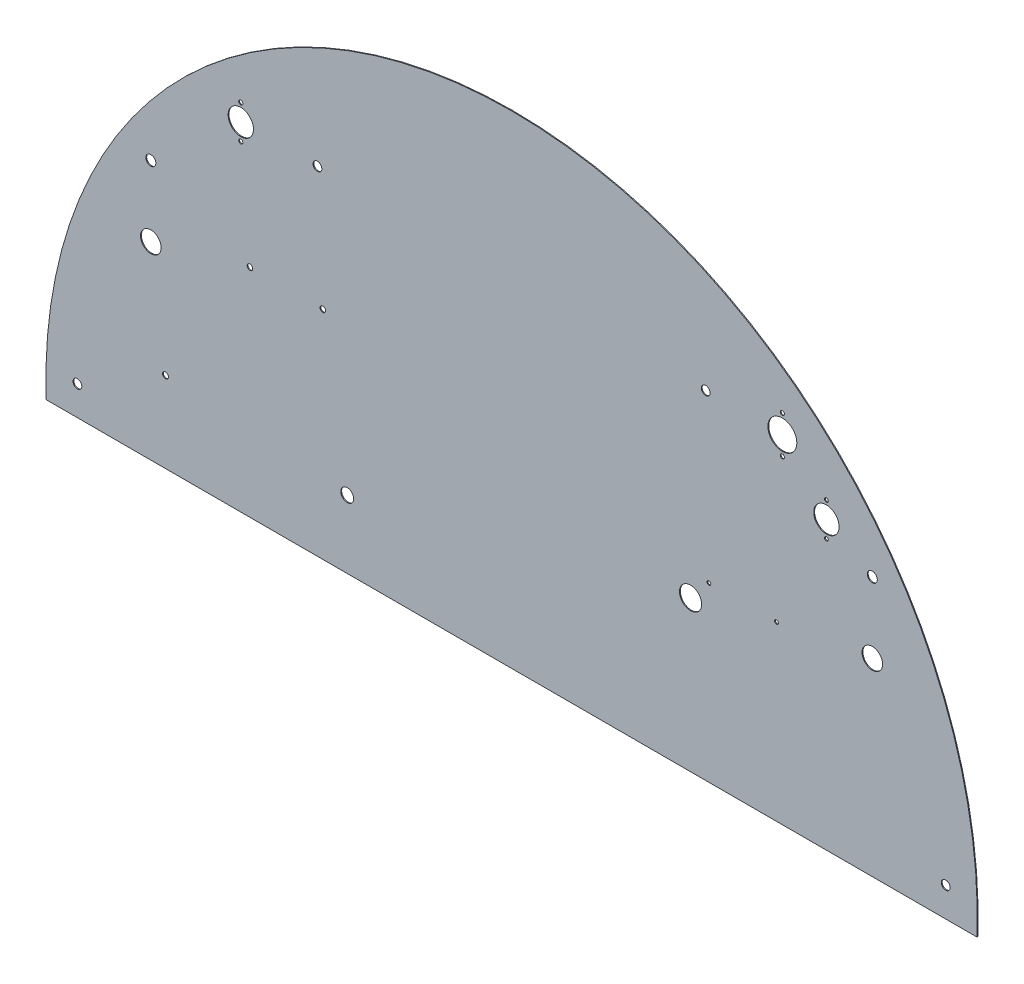
from build123d import *

# Parameters (mm, degrees)
BASE_SKETCH_R                              = 3.81
BASE_W_MOUNT_HOLES_DEPTH                   = 0.7366
THROTTLE_AND_CHOKE_CUTOUT_SKETCH_R         = 8.89
THROTTLE_AND_CHOKE_CUTOUT_SKETCH_R_2       = 4.318
THROTTLE_AND_CHOKE_CUTOUTS_DEPTH           = 872.38344995
STARTER_RELAY_MOUNT_SKETCH_R               = 2.38125
STARTER_RELAY_MOUNT_DEPTH                  = 872.38344995
OIL_PRESSURE_SENDER_CLAMP_MOUNT_SKETCH_R   = 2.54
OIL_PRESSURE_SENDER_CLAMP_MOUNT_DEPTH      = 872.38344995
STARTER_POWER_CUTOUT_SKETCH_R              = 5.588
STARTER_POWER_CUTOUT_DEPTH                 = 872.38344995
FUEL_RETURN_CUTOUT_SKETCH_R                = 9.5758
FUEL_RETURN_CUTOUT_DEPTH                   = 872.38344995
BRAKE_MASTER_CYL_MOUNT_SKETCH_R            = 1.6256
BRAKE_MASTER_CYL_MOUNT_DEPTH               = 872.38344995
CUTOUT_AS012_INSTRUMENTATION_RIGHT_S_R     = 10.94994
CUTOUT_AS012_INSTRUMENTATION_RIGHT_S_R_2   = 1.8034
CUTOUT_AS012_INSTRUMENTATION_RIGHT_DEPTH   = 872.38344995
CUTOUT_AS014_TACH_AND_CDI_ENABLE_2_R       = 12.4968
CUTOUT_AS014_TACH_AND_CDI_ENABLE_2_R_2     = 1.8034
CUTOUT_AS014_TACH_AND_CDI_ENABLES_LE_DEPTH = 872.38344995
CUTOUT_AS012_INSTRUMENTATION_LEFT_SK_R     = 10.94994
CUTOUT_AS012_INSTRUMENTATION_LEFT_SK_R_2   = 1.6002
CUTOUT_AS012_INSTRUMENTATION_LEFT_DEPTH    = 872.38344995


with BuildPart() as part:
    # Base Sketch → Base w Mount Holes (new body)
    with BuildSketch(Plane.XY):
        with BuildLine():
            ThreePointArc((777.875, -25.4), (375.44375, 392.163736759), (-26.9875, -25.4))
            Line((-26.9875, -25.4), (777.875, -25.4))
        make_face()
        Circle(BASE_SKETCH_R, mode=Mode.SUBTRACT)
        with Locations((750.8875, 0)):
            Circle(BASE_SKETCH_R, mode=Mode.SUBTRACT)
        with Locations((207.565625, 266.7)):
            Circle(BASE_SKETCH_R, mode=Mode.SUBTRACT)
        with Locations((543.321875, 266.7)):
            Circle(BASE_SKETCH_R, mode=Mode.SUBTRACT)
    extrude(amount=BASE_W_MOUNT_HOLES_DEPTH)

    # Throttle and Choke Cutout Sketch → Throttle and Choke Cutouts (cut, through all)
    with BuildSketch(Plane.XY.offset(0.7366)):
        with Locations((63.5, 138.1125)):
            Circle(THROTTLE_AND_CHOKE_CUTOUT_SKETCH_R)
        with Locations((63.5, 199.0725)):
            Circle(THROTTLE_AND_CHOKE_CUTOUT_SKETCH_R_2)
        with Locations((687.3875, 138.1125)):
            Circle(THROTTLE_AND_CHOKE_CUTOUT_SKETCH_R)
        with Locations((687.3875, 199.0725)):
            Circle(THROTTLE_AND_CHOKE_CUTOUT_SKETCH_R_2)
    extrude(amount=-THROTTLE_AND_CHOKE_CUTOUTS_DEPTH, mode=Mode.SUBTRACT)

    # Starter Relay Mount Sketch → Starter Relay Mount (cut, through all)
    with BuildSketch(Plane.XY.offset(0.7366)):
        with Locations((149.225, 161.925)):
            Circle(STARTER_RELAY_MOUNT_SKETCH_R)
        with Locations((212.217, 161.925)):
            Circle(STARTER_RELAY_MOUNT_SKETCH_R)
    extrude(amount=-STARTER_RELAY_MOUNT_DEPTH, mode=Mode.SUBTRACT)

    # Oil Pressure Sender Clamp Mount Sketch → Oil Pressure Sender Clamp Mount (cut, through all)
    with BuildSketch(Plane.XY.offset(0.7366)):
        with Locations((76.2, 44.45)):
            Circle(OIL_PRESSURE_SENDER_CLAMP_MOUNT_SKETCH_R)
    extrude(amount=-OIL_PRESSURE_SENDER_CLAMP_MOUNT_DEPTH, mode=Mode.SUBTRACT)

    # Starter Power Cutout Sketch → Starter Power Cutout (cut, through all)
    with BuildSketch(Plane.XY.offset(0.7366)):
        with Locations((233.3625, 33.3375)):
            Circle(STARTER_POWER_CUTOUT_SKETCH_R)
    extrude(amount=-STARTER_POWER_CUTOUT_DEPTH, mode=Mode.SUBTRACT)

    # Fuel Return Cutout Sketch → Fuel Return Cutout (cut, through all)
    with BuildSketch(Plane.XY.offset(0.7366)):
        with Locations((530.225, 104.775)):
            Circle(FUEL_RETURN_CUTOUT_SKETCH_R)
    extrude(amount=-FUEL_RETURN_CUTOUT_DEPTH, mode=Mode.SUBTRACT)

    # Brake Master Cyl Mount Sketch → Brake Master Cyl Mount (cut, through all)
    with BuildSketch(Plane.XY.offset(0.7366)):
        with Locations((546.1, 123.825)):
            Circle(BRAKE_MASTER_CYL_MOUNT_SKETCH_R)
        with Locations((604.52, 123.825)):
            Circle(BRAKE_MASTER_CYL_MOUNT_SKETCH_R)
    extrude(amount=-BRAKE_MASTER_CYL_MOUNT_DEPTH, mode=Mode.SUBTRACT)

    # Cutout - AS012 - Instrumentation Right Sketch → Cutout - AS012 - Instrumentation Right (cut, through all)
    with BuildSketch(Plane.XY.offset(0.7366)):
        with Locations((141.2875, 266.7)):
            Circle(CUTOUT_AS012_INSTRUMENTATION_RIGHT_S_R)
        with Locations((141.2875, 252.14961)):
            Circle(CUTOUT_AS012_INSTRUMENTATION_RIGHT_S_R_2)
        with Locations((141.2875, 281.25039)):
            Circle(CUTOUT_AS012_INSTRUMENTATION_RIGHT_S_R_2)
    extrude(amount=-CUTOUT_AS012_INSTRUMENTATION_RIGHT_DEPTH, mode=Mode.SUBTRACT)

    # Cutout - AS014 - Tach and CDI Enable 2 → Cutout - AS014 - Tach and CDI Enables Le (cut, through all)
    with BuildSketch(Plane.XY.offset(0.7366)):
        with Locations((609.6, 266.7)):
            Circle(CUTOUT_AS014_TACH_AND_CDI_ENABLE_2_R)
        with Locations((609.6, 282.94965)):
            Circle(CUTOUT_AS014_TACH_AND_CDI_ENABLE_2_R_2)
        with Locations((609.6, 250.45035)):
            Circle(CUTOUT_AS014_TACH_AND_CDI_ENABLE_2_R_2)
    extrude(amount=-CUTOUT_AS014_TACH_AND_CDI_ENABLES_LE_DEPTH, mode=Mode.SUBTRACT)

    # Cutout - AS012 - Instrumentation Left Sketch → Cutout - AS012 - Instrumentation Left (cut, through all)
    with BuildSketch(Plane.XY.offset(0.7366)):
        with Locations((647.7, 222.25)):
            Circle(CUTOUT_AS012_INSTRUMENTATION_LEFT_SK_R)
        with Locations((647.7, 236.80039)):
            Circle(CUTOUT_AS012_INSTRUMENTATION_LEFT_SK_R_2)
        with Locations((647.7, 207.69961)):
            Circle(CUTOUT_AS012_INSTRUMENTATION_LEFT_SK_R_2)
    extrude(amount=-CUTOUT_AS012_INSTRUMENTATION_LEFT_DEPTH, mode=Mode.SUBTRACT)


solid = part.part
